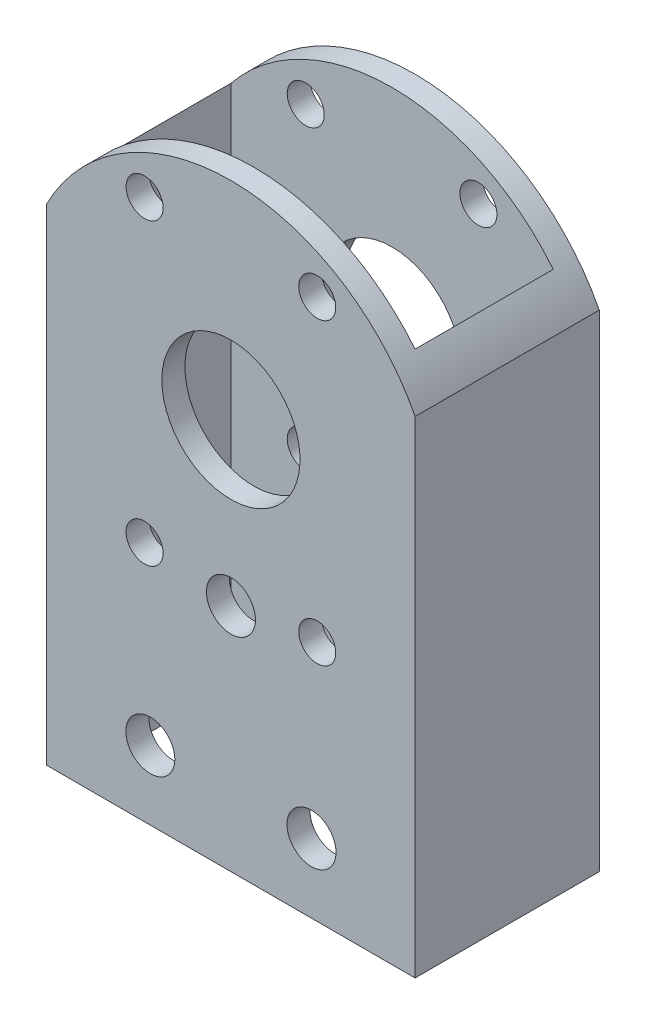
from build123d import *

# Parameters (mm, degrees)
SKETCH1_W               = 50.8
SKETCH1_H               = 25.4
SKETCH1_W_2             = 44.45
SKETCH1_H_2             = 19.05
EXTRUDE_THIN1_DEPTH     = 82.55
F_10_CLEARANCE_HOLE1_D  = 5.1054
CUT_EXTRUDE2_DEPTH      = 91.02678768
CUT_EXTRUDE2_DEPTH_BACK = 91.02678768
SKETCH7_R               = 9.525
F_1_4_CLEARANCE_HOLE2_D = 6.7564
CUT_EXTRUDE3_DEPTH      = 91.02678768
F_1_4_CLEARANCE_HOLE1_D = 6.7564


with BuildPart() as part:
    # Sketch1 → Extrude-Thin1 (new body)
    with BuildSketch(Plane(origin=(0, 0, 0), x_dir=(1, 0, 0), z_dir=(0, 1, 0))):
        Rectangle(SKETCH1_W, SKETCH1_H)
        Rectangle(SKETCH1_W_2, SKETCH1_H_2, mode=Mode.SUBTRACT)
    extrude(amount=EXTRUDE_THIN1_DEPTH)

    # #10 Clearance Hole1 (through all)
    with Locations(Plane(origin=(0, 0, -12.7), x_dir=(-1, 0, 0), z_dir=(0, 0, -1))):
        with Locations((-11.90625, 33.352770072), (-11.90625, 74.597229928), (11.90625, 74.597229928), (11.90625, 33.352770072)):
            Hole(F_10_CLEARANCE_HOLE1_D / 2)

    # Sketch7 → Cut-Extrude2 (cut, two sides: drawn at the far end of the back side and taken through both)
    with BuildSketch(Plane(origin=(0, 0, -12.7), x_dir=(-1, 0, 0), z_dir=(0, 0, -1)).offset(-CUT_EXTRUDE2_DEPTH_BACK)):
        with Locations((0, 53.975)):
            Circle(SKETCH7_R)
    extrude(amount=CUT_EXTRUDE2_DEPTH + CUT_EXTRUDE2_DEPTH_BACK, mode=Mode.SUBTRACT)

    # 1/4 Clearance Hole2 (through all)
    with Locations(Plane.XY.offset(12.7)):
        with Locations((-11.1125, 9.525), (11.1125, 9.525), (-109.171479686, 68.785430569)):
            Hole(F_1_4_CLEARANCE_HOLE2_D / 2)

    # Sketch10 → Cut-Extrude3 (cut, through all)
    with BuildSketch(Plane(origin=(0, 0, -12.7), x_dir=(-1, 0, 0), z_dir=(0, 0, -1))):
        with BuildLine():
            Line((25.4, 82.55), (0, 82.55))
            ThreePointArc((0, 82.55), (14.873790542, 78.373790542), (25.4, 67.065860361))
            Line((25.4, 67.065860361), (25.4, 82.55))
        make_face()
        with BuildLine():
            Line((-25.4, 82.55), (-25.4, 67.065860361))
            ThreePointArc((-25.4, 67.065860361), (-14.873790542, 78.373790542), (0, 82.55))
            Line((0, 82.55), (-25.4, 82.55))
        make_face()
    extrude(amount=-CUT_EXTRUDE3_DEPTH, mode=Mode.SUBTRACT)

    # 1/4 Clearance Hole1 (through all)
    with Locations(Plane.XY.offset(12.7)):
        with Locations((0, 31.75)):
            Hole(F_1_4_CLEARANCE_HOLE1_D / 2)


solid = part.part
